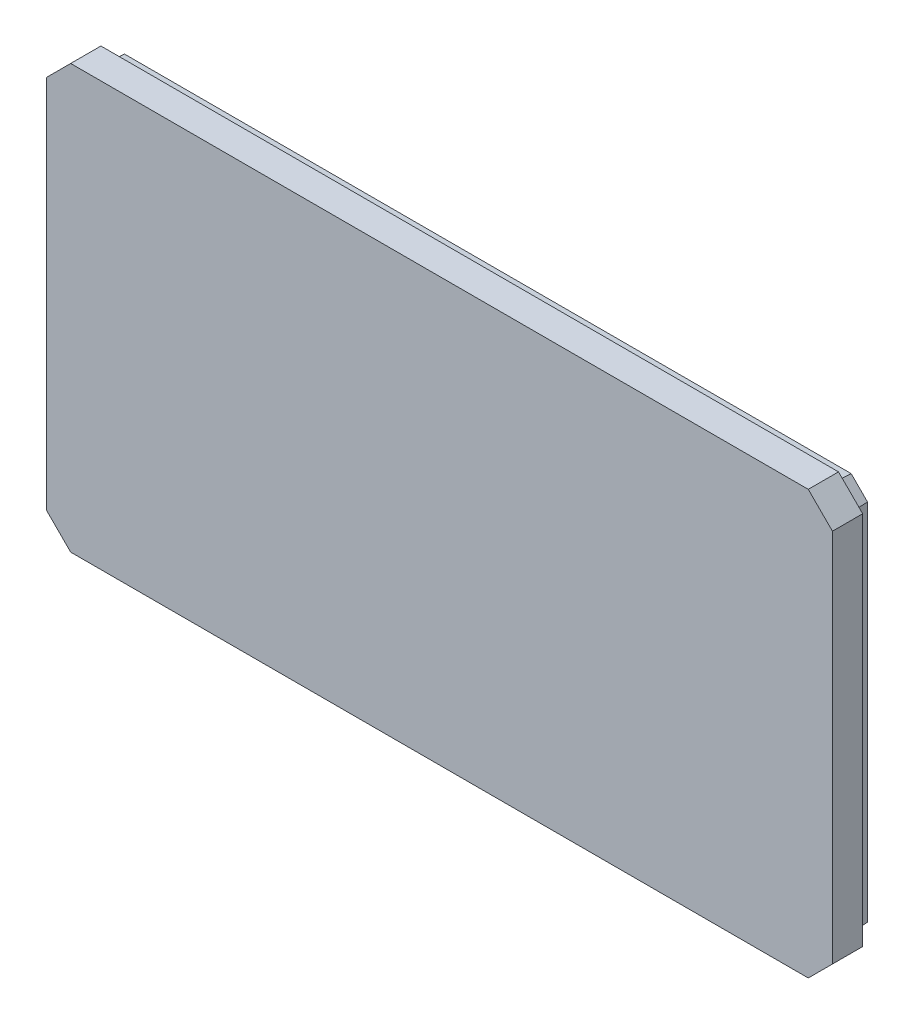
from build123d import *

# Parameters (mm, degrees)
CROQUIS1_W              = 65
CROQUIS1_H              = 35
SALIENTE_EXTRUIR1_DEPTH = 2.5
CHAMFER1_SIZE           = 2
BOSS_EXTRUDE1_START     = -2.5
BOSS_EXTRUDE1_DEPTH     = 1.5
CHAMFER2_SIZE           = 1.5
CHAMFER2_SIZE_2         = 0.1
SKETCH2_W               = 1.1
SKETCH2_H               = 2.1
CUT_EXTRUDE1_DEPTH      = 0.6


with BuildPart() as part:
    # Croquis1 → Saliente-Extruir1 (new body)
    with BuildSketch(Plane.XY):
        Rectangle(CROQUIS1_W, CROQUIS1_H)
    extrude(amount=SALIENTE_EXTRUIR1_DEPTH)

    # Chamfer1
    chamfer1_edges = [part.edges().sort_by_distance(p)[0] for p in [
        (-32.5, 17.5, 1.25),
        (-32.5, -17.5, 1.25),
        (32.5, -17.5, 1.25),
        (32.5, 17.5, 1.25),
    ]]
    chamfer(chamfer1_edges, length=CHAMFER1_SIZE)

    # Sketch1 → Boss-Extrude1 (add)
    with BuildSketch(Plane.XY.offset(2.5).offset(BOSS_EXTRUDE1_START)):
        Polygon((-30.085786438, -16.5), (30.085786438, -16.5), (31.5, -15.085786438), (31.5, 15.085786438), (30.085786438, 16.5), (-30.085786438, 16.5), (-31.5, 15.085786438), (-31.5, -15.085786438), align=None)
        Polygon((-29.671572875, -15.5), (29.671572875, -15.5), (30.5, -14.671572875), (30.5, 14.671572875), (29.671572875, 15.5), (-29.671572875, 15.5), (-30.5, 14.671572875), (-30.5, -14.671572875), align=None, mode=Mode.SUBTRACT)
    extrude(amount=-BOSS_EXTRUDE1_DEPTH)

    # Chamfer2
    # the kernel refuses this chamfer: 1.5, 0.1 mm, written as the material it takes off along each edge
    with BuildSketch(Plane(origin=(34.257490553, 12.328295884, -1.5), x_dir=(0.0018092267925963327, 0.001809226792596321, 0.9999967266930556), z_dir=(-0.7071067811865454, 0.7071067811865498, 0))) as chamfer2_piece_1_section:
        Polygon((CHAMFER2_SIZE * 0.999996726693, -CHAMFER2_SIZE * 0.0025586330675), (-CHAMFER2_SIZE_2 * 0.0025586330675, -CHAMFER2_SIZE_2 * 0.999996726693), (0, 0), align=None)
    chamfer2_piece_1 = extrude(amount=9.799361077, mode=Mode.PRIVATE)
    chamfer2_piece_1 = split(chamfer2_piece_1, bisect_by=Plane(origin=(30.78142094, 15.78142094, 0), z_dir=(0, 0, -1)), keep=Keep.TOP, mode=Mode.PRIVATE)
    add(chamfer2_piece_1, mode=Mode.SUBTRACT)
    with BuildSketch(Plane(origin=(33.985466976, 16.5, -1.5), x_dir=(0, 0.0025586330674999794, 0.9999967266930556), z_dir=(-1, 0, 0))) as chamfer2_piece_2_section:
        Polygon((CHAMFER2_SIZE * 0.999996726693, -CHAMFER2_SIZE * 0.0025586330675), (-CHAMFER2_SIZE_2 * 0.0025586330675, -CHAMFER2_SIZE_2 * 0.999996726693), (0, 0), align=None)
    chamfer2_piece_2 = extrude(amount=67.970933952, mode=Mode.PRIVATE)
    chamfer2_piece_2 = split(chamfer2_piece_2, bisect_by=Plane(origin=(0, 16.483775747, 0), z_dir=(0, 0, -1)), keep=Keep.TOP, mode=Mode.PRIVATE)
    add(chamfer2_piece_2, mode=Mode.SUBTRACT)
    with BuildSketch(Plane(origin=(-27.328295884, 19.257490553, -1.5), x_dir=(-0.0018092267925980316, 0.0018092267925980384, 0.9999967266930556), z_dir=(-0.7071067811865489, -0.7071067811865462, 0))) as chamfer2_piece_3_section:
        Polygon((CHAMFER2_SIZE * 0.999996726693, -CHAMFER2_SIZE * 0.0025586330675), (-CHAMFER2_SIZE_2 * 0.0025586330675, -CHAMFER2_SIZE_2 * 0.999996726693), (0, 0), align=None)
    chamfer2_piece_3 = extrude(amount=9.799361077, mode=Mode.PRIVATE)
    chamfer2_piece_3 = split(chamfer2_piece_3, bisect_by=Plane(origin=(-30.78142094, 15.78142094, 0), z_dir=(0, 0, -1)), keep=Keep.TOP, mode=Mode.PRIVATE)
    add(chamfer2_piece_3, mode=Mode.SUBTRACT)
    with BuildSketch(Plane(origin=(-31.5, 18.985466976, -1.5), x_dir=(-0.0025586330674999794, 0, 0.9999967266930556), z_dir=(0, -1, 0))) as chamfer2_piece_4_section:
        Polygon((CHAMFER2_SIZE * 0.999996726693, -CHAMFER2_SIZE * 0.0025586330675), (-CHAMFER2_SIZE_2 * 0.0025586330675, -CHAMFER2_SIZE_2 * 0.999996726693), (0, 0), align=None)
    chamfer2_piece_4 = extrude(amount=37.970933952, mode=Mode.PRIVATE)
    chamfer2_piece_4 = split(chamfer2_piece_4, bisect_by=Plane(origin=(-31.483775747, 0, 0), z_dir=(0, 0, -1)), keep=Keep.TOP, mode=Mode.PRIVATE)
    add(chamfer2_piece_4, mode=Mode.SUBTRACT)
    with BuildSketch(Plane(origin=(-34.257490553, -12.328295884, -1.5), x_dir=(-0.0018092267925951928, -0.0018092267925951832, 0.9999967266930556), z_dir=(0.7071067811865458, -0.7071067811865493, 0))) as chamfer2_piece_5_section:
        Polygon((CHAMFER2_SIZE * 0.999996726693, -CHAMFER2_SIZE * 0.0025586330675), (-CHAMFER2_SIZE_2 * 0.0025586330675, -CHAMFER2_SIZE_2 * 0.999996726693), (0, 0), align=None)
    chamfer2_piece_5 = extrude(amount=9.799361077, mode=Mode.PRIVATE)
    chamfer2_piece_5 = split(chamfer2_piece_5, bisect_by=Plane(origin=(-30.78142094, -15.78142094, 0), z_dir=(0, 0, -1)), keep=Keep.TOP, mode=Mode.PRIVATE)
    add(chamfer2_piece_5, mode=Mode.SUBTRACT)
    with BuildSketch(Plane(origin=(31.5, -18.985466976, -1.5), x_dir=(0.0025586330674999794, 0, 0.9999967266930556), z_dir=(0, 1, 0))) as chamfer2_piece_6_section:
        Polygon((CHAMFER2_SIZE * 0.999996726693, -CHAMFER2_SIZE * 0.0025586330675), (-CHAMFER2_SIZE_2 * 0.0025586330675, -CHAMFER2_SIZE_2 * 0.999996726693), (0, 0), align=None)
    chamfer2_piece_6 = extrude(amount=37.970933952, mode=Mode.PRIVATE)
    chamfer2_piece_6 = split(chamfer2_piece_6, bisect_by=Plane(origin=(31.483775747, 0, 0), z_dir=(0, 0, -1)), keep=Keep.TOP, mode=Mode.PRIVATE)
    add(chamfer2_piece_6, mode=Mode.SUBTRACT)
    with BuildSketch(Plane(origin=(27.328295884, -19.257490553, -1.5), x_dir=(0.0018092267925980349, -0.0018092267925980349, 0.9999967266930556), z_dir=(0.7071067811865476, 0.7071067811865476, 0))) as chamfer2_piece_7_section:
        Polygon((CHAMFER2_SIZE * 0.999996726693, -CHAMFER2_SIZE * 0.0025586330675), (-CHAMFER2_SIZE_2 * 0.0025586330675, -CHAMFER2_SIZE_2 * 0.999996726693), (0, 0), align=None)
    chamfer2_piece_7 = extrude(amount=9.799361077, mode=Mode.PRIVATE)
    chamfer2_piece_7 = split(chamfer2_piece_7, bisect_by=Plane(origin=(30.78142094, -15.78142094, 0), z_dir=(0, 0, -1)), keep=Keep.TOP, mode=Mode.PRIVATE)
    add(chamfer2_piece_7, mode=Mode.SUBTRACT)
    with BuildSketch(Plane(origin=(-33.985466976, -16.5, -1.5), x_dir=(0, -0.0025586330674999794, 0.9999967266930556), z_dir=(1, 0, 0))) as chamfer2_piece_8_section:
        Polygon((CHAMFER2_SIZE * 0.999996726693, -CHAMFER2_SIZE * 0.0025586330675), (-CHAMFER2_SIZE_2 * 0.0025586330675, -CHAMFER2_SIZE_2 * 0.999996726693), (0, 0), align=None)
    chamfer2_piece_8 = extrude(amount=67.970933952, mode=Mode.PRIVATE)
    chamfer2_piece_8 = split(chamfer2_piece_8, bisect_by=Plane(origin=(0, -16.483775747, 0), z_dir=(0, 0, -1)), keep=Keep.TOP, mode=Mode.PRIVATE)
    add(chamfer2_piece_8, mode=Mode.SUBTRACT)

    # Sketch2 → Cut-Extrude1 (cut)
    with BuildSketch(Plane(origin=(0, 0, 0), x_dir=(-1, 0, 0), z_dir=(0, 0, -1))):
        with Locations((-31.5, 0)):
            Rectangle(SKETCH2_W, SKETCH2_H)
        with Locations((31.5, 0)):
            Rectangle(SKETCH2_W, SKETCH2_H)
    extrude(amount=CUT_EXTRUDE1_DEPTH, mode=Mode.SUBTRACT)


solid = part.part
